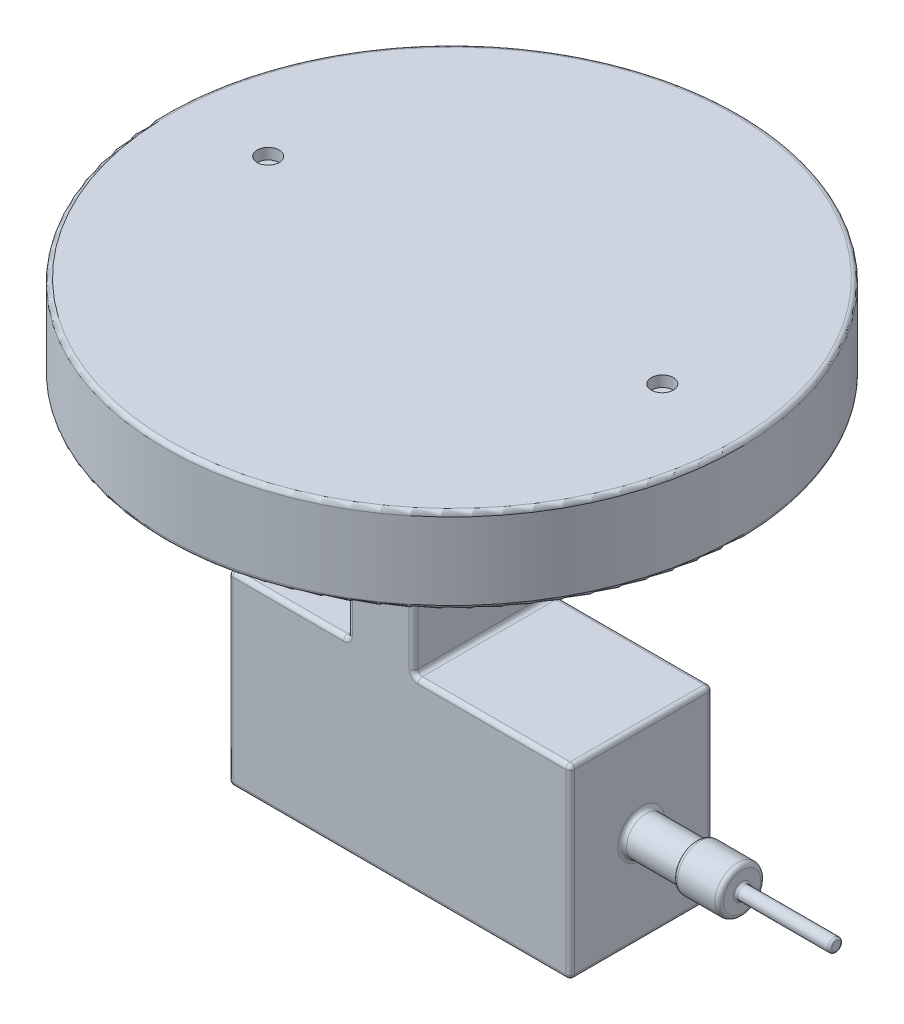
from build123d import *

# Parameters (mm, degrees)
SKETCH1_W           = 156
SKETCH1_H           = 65
BOSS_EXTRUDE1_DEPTH = 85
SKETCH2_R           = 10.5
BOSS_EXTRUDE2_DEPTH = 46
SKETCH3_R           = 3
BOSS_EXTRUDE3_DEPTH = 43
SKETCH4_R           = 10.5
SKETCH4_R_2         = 8.75
CUT_EXTRUDE2_DEPTH  = 25
SKETCH5_W           = 30
SKETCH5_H           = 65
BOSS_EXTRUDE4_DEPTH = 95
SKETCH6_R           = 131
BOSS_EXTRUDE5_DEPTH = 39
SKETCH7_R           = 5
CUT_EXTRUDE3_DEPTH  = 5
FILLET10_R          = 2
FILLET11_R          = 2
FILLET12_R          = 2
FILLET13_R          = 2
FILLET14_R          = 1
FILLET15_R          = 1


with BuildPart() as part:
    # Sketch1 → Boss-Extrude1 (new body)
    with BuildSketch(Plane(origin=(0, 0, 0), x_dir=(1, 0, 0), z_dir=(0, 1, 0))):
        with Locations((78, 32.5)):
            Rectangle(SKETCH1_W, SKETCH1_H)
    extrude(amount=BOSS_EXTRUDE1_DEPTH)

    # Sketch2 → Boss-Extrude2 (add)
    with BuildSketch(Plane(origin=(156, 0, 0), x_dir=(0, 0, -1), z_dir=(1, 0, 0))):
        with Locations(Location((32.5, 42.5, 0), (0, 0, 180))):
            Circle(SKETCH2_R)
    extrude(amount=BOSS_EXTRUDE2_DEPTH)

    # Sketch3 → Boss-Extrude3 (add)
    with BuildSketch(Plane(origin=(202, 0, 0), x_dir=(0, 0, -1), z_dir=(1, 0, 0))):
        with Locations((32.5, 42.5)):
            Circle(SKETCH3_R)
    extrude(amount=BOSS_EXTRUDE3_DEPTH)

    # Sketch4 → Cut-Extrude2 (cut)
    with BuildSketch(Plane(origin=(156, 0, 0), x_dir=(0, 0, -1), z_dir=(1, 0, 0))):
        with Locations((32.5, 42.5)):
            Circle(SKETCH4_R)
        with Locations((32.5, 42.5)):
            Circle(SKETCH4_R_2, mode=Mode.SUBTRACT)
    extrude(amount=CUT_EXTRUDE2_DEPTH, mode=Mode.SUBTRACT)

    # Sketch5 → Boss-Extrude4 (add)
    with BuildSketch(Plane(origin=(0, 85, 0), x_dir=(1, 0, 0), z_dir=(0, 1, 0))):
        with Locations((69.5, 32.5)):
            Rectangle(SKETCH5_W, SKETCH5_H)
    extrude(amount=BOSS_EXTRUDE4_DEPTH)

    # Sketch6 → Boss-Extrude5 (add)
    with BuildSketch(Plane(origin=(0, 180, 0), x_dir=(1, 0, 0), z_dir=(0, 1, 0))):
        with Locations(Location((69.5, 32.5, 0), (0, 0, 270))):
            Circle(SKETCH6_R)
    extrude(amount=BOSS_EXTRUDE5_DEPTH)

    # Sketch7 → Cut-Extrude3 (cut)
    with BuildSketch(Plane(origin=(0, 219, 0), x_dir=(-1, 0, 0), z_dir=(0, 1, 0))):
        with Locations(Location((20.5, -38.587995043, 0), (0, 0, 90))):
            Circle(SKETCH7_R)
        with Locations(Location((-159.5, -38.587995043, 0), (0, 0, 90))):
            Circle(SKETCH7_R)
    extrude(amount=-CUT_EXTRUDE3_DEPTH, mode=Mode.SUBTRACT)

    # Fillet10
    fillet10_edges = [part.edges().sort_by_distance(p)[0] for p in [
        (0, 42.5, 0),
    ]]
    fillet(fillet10_edges, radius=FILLET10_R)

    # Fillet11
    fillet11_edges = [part.edges().sort_by_distance(p)[0] for p in [
        (54.5, 132.5, -65),
        (54.5, 132.5, 0),
        (79, 0, 0),
        (54.5, 85, -32.5),
        (84.5, 85, -32.5),
        (0, 0, -33.5),
        (0, 85, -33.5),
        (28.25, 85, 0),
        (27.25, 85, -65),
        (0, 42.5, -65),
        (0.585786438, 0, -0.585786438),
        (0.585786438, 85, -0.585786438),
    ]]
    fillet(fillet11_edges, radius=FILLET11_R)

    # Fillet12
    # the kernel refuses this fillet: 2 mm, written as the material it takes off along each edge
    with BuildSketch(Plane(origin=(2, 2, -63), x_dir=(0, 0, -1), z_dir=(0, -1, 0))) as fillet12_piece_1_section:
        Polygon((0, 0), (FILLET12_R, 0), (FILLET12_R, -FILLET12_R), (0, -FILLET12_R), align=None)
    fillet12_piece_1 = extrude(amount=FILLET12_R, mode=Mode.PRIVATE)
    fillet12_piece_1 = fillet12_piece_1 - Plane(origin=(2, 2, -63), x_dir=(0.7071067811865475, 0, 0.7071067811865475), z_dir=(0, -1, 0)) * Sphere(FILLET12_R, mode=Mode.PRIVATE)
    add(fillet12_piece_1, mode=Mode.SUBTRACT)
    with BuildSketch(Plane(origin=(161, 85, -65), x_dir=(0, 0, 1), z_dir=(-1, 0, 0))) as fillet12_piece_2:
        with BuildLine():
            CenterArc((FILLET12_R, -FILLET12_R), FILLET12_R, 90, 90)
            Line((0, -FILLET12_R), (0, 0))
            Line((0, 0), (FILLET12_R, 0))
        make_face()
    extrude(amount=74.5, mode=Mode.SUBTRACT)
    with BuildSketch(Plane(origin=(84.5, 87, 0), x_dir=(-1, 0, 0), z_dir=(0, 1, 0)), Plane(origin=(84.5, 87, -65), x_dir=(0, 0, 1), z_dir=(0, 1, 0))) as fillet12_piece_3:
        with BuildLine():
            CenterArc((FILLET12_R, -FILLET12_R), FILLET12_R, 90, 90)
            Line((0, -FILLET12_R), (0, 0))
            Line((0, 0), (FILLET12_R, 0))
        make_face()
    extrude(amount=93, mode=Mode.SUBTRACT)
    with BuildSketch(Plane(origin=(161, 0, -65), x_dir=(0, 0, 1), z_dir=(-1, 0, 0))) as fillet12_piece_4:
        with BuildLine():
            CenterArc((FILLET12_R, FILLET12_R), FILLET12_R, 180, 90)
            Line((0, FILLET12_R), (0, 0))
            Line((0, 0), (FILLET12_R, 0))
        make_face()
    extrude(amount=159, mode=Mode.SUBTRACT)
    with BuildSketch(Plane(origin=(86.5, 85, 0), x_dir=(0, -1, 0), z_dir=(1, 0, 0))) as fillet12_piece_5:
        with BuildLine():
            CenterArc((FILLET12_R, FILLET12_R), FILLET12_R, 180, 90)
            Line((0, FILLET12_R), (0, 0))
            Line((0, 0), (FILLET12_R, 0))
        make_face()
    extrude(amount=74.5, mode=Mode.SUBTRACT)
    with BuildSketch(Plane(origin=(156, 0, -2), x_dir=(0, 1, 0), z_dir=(0, 0, -1))) as fillet12_piece_6:
        with BuildLine():
            CenterArc((FILLET12_R, -FILLET12_R), FILLET12_R, 90, 90)
            Line((0, -FILLET12_R), (0, 0))
            Line((0, 0), (FILLET12_R, 0))
        make_face()
    extrude(amount=68, mode=Mode.SUBTRACT)
    with BuildSketch(Plane(origin=(156, 2, 0), x_dir=(-1, 0, 0), z_dir=(0, 1, 0))) as fillet12_piece_7:
        with BuildLine():
            CenterArc((FILLET12_R, -FILLET12_R), FILLET12_R, 90, 90)
            Line((0, -FILLET12_R), (0, 0))
            Line((0, 0), (FILLET12_R, 0))
        make_face()
    extrude(amount=88, mode=Mode.SUBTRACT)
    with BuildSketch(Plane(origin=(156, 2, -2), x_dir=(0, 0, 1), z_dir=(0, 1, 0))) as fillet12_piece_8:
        with BuildLine():
            CenterArc((2 - FILLET12_R, -FILLET12_R), FILLET12_R, 0, 90)
            Line((2 - FILLET12_R, 0), (2, 0))
            Line((2, 0), (2, -FILLET12_R))
        make_face()
    revolve(axis=Axis((156, 2, -2), (1, 0, 0)), revolution_arc=90, mode=Mode.SUBTRACT)
    with BuildSketch(Plane(origin=(86.5, 87, -65), x_dir=(-1, 0, 0), z_dir=(0, 1, 0))) as fillet12_piece_9:
        with BuildLine():
            CenterArc((2 + FILLET12_R, FILLET12_R), FILLET12_R, 180, 90)
            Line((2 + FILLET12_R, 0), (2, 0))
            Line((2, 0), (2, FILLET12_R))
        make_face()
    revolve(axis=Axis((86.5, 87, -65), (0, 0, 1)), revolution_arc=90, mode=Mode.SUBTRACT)
    with BuildSketch(Plane(origin=(86.5, 87, 0), x_dir=(-1, 0, 0), z_dir=(0, 1, 0))) as fillet12_piece_10:
        with BuildLine():
            CenterArc((2 + FILLET12_R, -FILLET12_R), FILLET12_R, 90, 90)
            Line((2, -FILLET12_R), (2, 0))
            Line((2, 0), (2 + FILLET12_R, 0))
        make_face()
    revolve(axis=Axis((86.5, 87, 0), (0, 0, 1)), revolution_arc=90, mode=Mode.SUBTRACT)

    # Fillet13
    # the kernel refuses this fillet: 2 mm, written as the material it adds along each edge
    with BuildSketch(Plane(origin=(156, 42.5, -32.5), x_dir=(0, 0, -1), z_dir=(0, -1, 0))) as fillet13_piece_1:
        with BuildLine():
            CenterArc((8.75 + FILLET13_R, FILLET13_R), FILLET13_R, 180, 90)
            Line((8.75, FILLET13_R), (8.75, 0))
            Line((8.75, 0), (8.75 + FILLET13_R, 0))
        make_face()
    revolve(axis=Axis((156, 42.5, -32.5), (1, 0, 0)))
    # the kernel refuses this fillet: 2 mm, written as the material it takes off along each edge
    with BuildSketch(Plane(origin=(154, 83, -2), x_dir=(0, 1, 0), z_dir=(1, 0, 0))) as fillet13_2_piece_1_section:
        Polygon((0, 0), (FILLET13_R * 1.02, 0), (FILLET13_R * 1.02, FILLET13_R * 1.02), (0, FILLET13_R * 1.02), align=None)
    fillet13_2_piece_1 = extrude(amount=FILLET13_R * 1.02, mode=Mode.PRIVATE)
    fillet13_2_piece_1 = fillet13_2_piece_1 - Plane(origin=(154, 83, -2), x_dir=(0, -0.7071067811865475, -0.7071067811865475), z_dir=(1, 0, 0)) * Sphere(FILLET13_R, mode=Mode.PRIVATE)
    add(fillet13_2_piece_1, mode=Mode.SUBTRACT)
    with BuildSketch(Plane(origin=(154, 2, -63), x_dir=(0, 0, -1), z_dir=(1, 0, 0))) as fillet13_2_piece_2_section:
        Polygon((0, 0), (FILLET13_R * 1.02, 0), (FILLET13_R * 1.02, -FILLET13_R * 1.02), (0, -FILLET13_R * 1.02), align=None)
    fillet13_2_piece_2 = extrude(amount=FILLET13_R * 1.02, mode=Mode.PRIVATE)
    fillet13_2_piece_2 = fillet13_2_piece_2 - Plane(origin=(154, 2, -63), x_dir=(0, 0.7071067811865475, 0.7071067811865475), z_dir=(1, 0, 0)) * Sphere(FILLET13_R, mode=Mode.PRIVATE)
    add(fillet13_2_piece_2, mode=Mode.SUBTRACT)
    with BuildSketch(Plane(origin=(156, 2, -65), x_dir=(0, 0, 1), z_dir=(0, 1, 0))) as fillet13_2_piece_3:
        with BuildLine():
            CenterArc((FILLET13_R, -FILLET13_R), FILLET13_R, 90, 90)
            Line((0, -FILLET13_R), (0, 0))
            Line((0, 0), (FILLET13_R, 0))
        make_face()
    extrude(amount=81, mode=Mode.SUBTRACT)
    with BuildSketch(Plane(origin=(156, 85, -2), x_dir=(0, -1, 0), z_dir=(0, 0, -1))) as fillet13_2_piece_4:
        with BuildLine():
            CenterArc((FILLET13_R, FILLET13_R), FILLET13_R, 180, 90)
            Line((0, FILLET13_R), (0, 0))
            Line((0, 0), (FILLET13_R, 0))
        make_face()
    extrude(amount=61, mode=Mode.SUBTRACT)
    with BuildSketch(Plane(origin=(156, 83, -63), x_dir=(0, 0, -1), z_dir=(0, -1, 0))) as fillet13_2_piece_5:
        with BuildLine():
            CenterArc((2 - FILLET13_R, -FILLET13_R), FILLET13_R, 0, 90)
            Line((2, -FILLET13_R), (2, 0))
            Line((2, 0), (2 - FILLET13_R, 0))
        make_face()
    revolve(axis=Axis((156, 83, -63), (1, 0, 0)), revolution_arc=90, mode=Mode.SUBTRACT)
    with BuildSketch(Plane(origin=(202, 42.5, -32.5), x_dir=(0, 0, 1), z_dir=(0, 1, 0))) as fillet13_2_piece_6:
        with BuildLine():
            CenterArc((10.5 - FILLET13_R, -FILLET13_R), FILLET13_R, 0, 90)
            Line((10.5 - FILLET13_R, 0), (10.5, 0))
            Line((10.5, 0), (10.5, -FILLET13_R))
        make_face()
    revolve(axis=Axis((202, 42.5, -32.5), (1, 0, 0)), mode=Mode.SUBTRACT)
    with BuildSketch(Plane(origin=(181, 42.5, -32.5), x_dir=(0, 0, 1), z_dir=(0, -1, 0))) as fillet13_2_piece_7:
        with BuildLine():
            CenterArc((8.5, -1.984313483), FILLET13_R, 0, 82.819244219)
            Line((10.5, -1.984313483), (10.5, 0))
            Line((10.5, 0), (8.75, 0))
        make_face()
    revolve(axis=Axis((181, 42.5, -32.5), (-1, 0, 0)), mode=Mode.SUBTRACT)
    with BuildSketch(Plane(origin=(69.5, 180, -32.5), x_dir=(0, 0, 1), z_dir=(-1, 0, 0))) as fillet13_2_piece_8:
        with BuildLine():
            CenterArc((131 - FILLET13_R, FILLET13_R), FILLET13_R, 270, 90)
            Line((131, FILLET13_R), (131, 0))
            Line((131, 0), (131 - FILLET13_R, 0))
        make_face()
    revolve(axis=Axis((69.5, 180, -32.5), (0, 1, 0)), mode=Mode.SUBTRACT)
    with BuildSketch(Plane(origin=(69.5, 219, -32.5), x_dir=(0, 0, 1), z_dir=(-1, 0, 0))) as fillet13_2_piece_9:
        with BuildLine():
            CenterArc((131 - FILLET13_R, -FILLET13_R), FILLET13_R, 0, 90)
            Line((131 - FILLET13_R, 0), (131, 0))
            Line((131, 0), (131, -FILLET13_R))
        make_face()
    revolve(axis=Axis((69.5, 219, -32.5), (0, 1, 0)), mode=Mode.SUBTRACT)

    # Fillet14
    fillet14_edges = [part.edges().sort_by_distance(p)[0] for p in [
        (245, 42.5, -29.5),
    ]]
    fillet(fillet14_edges, radius=FILLET14_R)

    # Fillet15
    fillet15_edges = [part.edges().sort_by_distance(p)[0] for p in [
        (202, 42.5, -29.5),
    ]]
    fillet(fillet15_edges, radius=FILLET15_R)


solid = part.part
